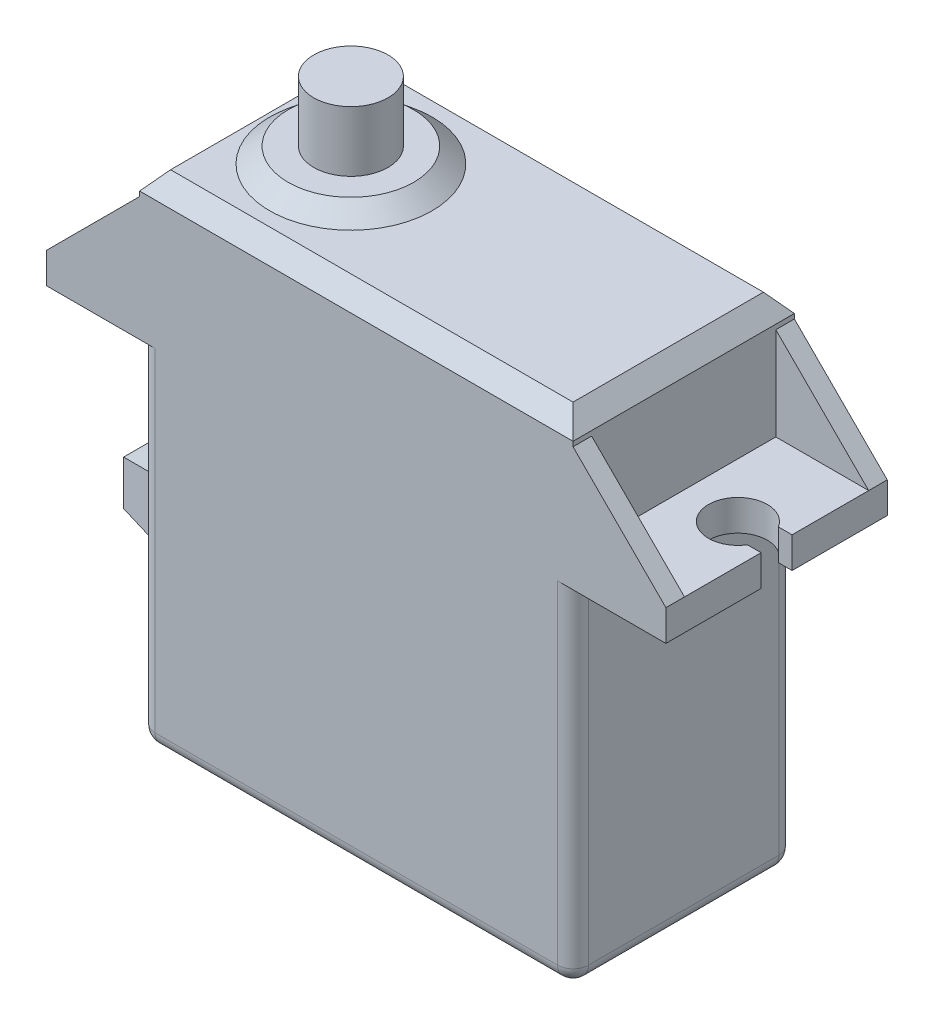
from build123d import *
from OCP.BRepFilletAPI import BRepFilletAPI_MakeChamfer

# Parameters (mm, degrees)
ESQUISSE1_W                  = 28
ESQUISSE1_H                  = 32
BOSS_EXTRU_1_DEPTH           = 7.15
BOSS_EXTRU_2_DEPTH           = 6
CHANFREIN1_SIZE              = 6
ENL_V_MAT_EXTRU_1_DEPTH      = 6
CHANFREIN1_OF_SYM_TRIE1_SIZE = 6
CONG_1_R                     = 1
ESQUISSE4_R                  = 5.25
BOSS_EXTRU_3_DEPTH           = 1
CHANFREIN2_SIZE2             = 1.191753593
CHANFREIN2_SIZE              = 1
ESQUISSE5_R                  = 2.4
BOSS_EXTRU_4_DEPTH           = 3.9
CHANFREIN3_SIZE              = 1
CHANFREIN3_SIZE2             = 1.191753593
ESQUISSE6_W                  = 7.5
ESQUISSE6_H                  = 5
BOSS_EXTRU_5_DEPTH           = 6
CHANFREIN4_SIZE              = 6
CHANFREIN4_SIZE_2            = 1.057961884


with BuildPart() as part:
    # Esquisse1 → Boss.-Extru.1 (new, symmetric)
    with BuildSketch(Plane.XY):
        Rectangle(ESQUISSE1_W, ESQUISSE1_H)
    extrude(amount=BOSS_EXTRU_1_DEPTH, both=True)

    # Esquisse2 → Boss.-Extru.2 (add)
    with BuildSketch(Plane.ZY.offset(14)):
        Polygon((5.95, 14.5), (7.15, 14.5), (7.15, 6.5), (5.366521974, 6.5), (-5.315928015, 6.5), (-7.15, 6.5), (-7.15, 14.5), (-5.95, 14.5), (-5.95, 8.5), (5.95, 8.5), align=None)
    boss_extru_2 = extrude(amount=BOSS_EXTRU_2_DEPTH)

    # Chanfrein1
    chanfrein1_edges = [part.edges().sort_by_distance(p)[0] for p in [
        (-20, 14.5, 6.55),
        (-20, 14.5, -6.55),
    ]]
    chamfer(chanfrein1_edges, length=CHANFREIN1_SIZE - 0.0001)  # a hair under: the kernel refuses the full size

    # Esquisse3 → Enlèv. mat.-Extru.1 (cut)
    with BuildSketch(Plane(origin=(0, 8.5, 0), x_dir=(1, 0, 0), z_dir=(0, 1, 0))):
        with BuildLine():
            Line((-20, 1), (-19.115549442, 1))
            ThreePointArc((-19.115549442, 1), (-15.6, 0), (-19.115549442, -1))
            Line((-19.115549442, -1), (-20, -1))
            Line((-20, -1), (-20, 1))
        make_face()
    enl_v_mat_extru_1 = extrude(amount=-ENL_V_MAT_EXTRU_1_DEPTH, mode=Mode.SUBTRACT)

    # Symétrie1: Boss.-Extru.2, Enlèv. mat.-Extru.1 across plane
    add(boss_extru_2.mirror(Plane(origin=(0, 0, 0), x_dir=(0, 0, 1), z_dir=(1, 0, 0))))
    add(enl_v_mat_extru_1.mirror(Plane(origin=(0, 0, 0), x_dir=(0, 0, 1), z_dir=(1, 0, 0))), mode=Mode.SUBTRACT)

    # Chanfrein1 of Symétrie1
    chanfrein1_of_sym_trie1_edges = [part.edges().sort_by_distance(p)[0] for p in [
        (20, 14.5, 6.55),
        (20, 14.5, -6.55),
    ]]
    chamfer(chanfrein1_of_sym_trie1_edges, length=CHANFREIN1_OF_SYM_TRIE1_SIZE - 0.0001)  # a hair under: the kernel refuses the full size

    # Congé1
    cong_1_edges = [part.edges().sort_by_distance(p)[0] for p in [
        (-14, -16, 0),
        (-14, -4.75, -7.15),
        (-14, -4.75, 7.15),
        (14, -4.75, -7.15),
        (14, -4.75, 7.15),
        (0, -16, -7.15),
        (0, -16, 7.15),
        (14, -16, 0),
    ]]
    fillet(cong_1_edges, radius=CONG_1_R)

    # Esquisse4 → Boss.-Extru.3 (add)
    with BuildSketch(Plane(origin=(0, 16, 0), x_dir=(1, 0, 0), z_dir=(0, 1, 0))):
        with Locations(Location((-7.5, 0, 0), (0, 0, 90))):
            Circle(ESQUISSE4_R)
    extrude(amount=BOSS_EXTRU_3_DEPTH)

    # Chanfrein2
    chanfrein2_edges = [part.edges().sort_by_distance(p)[0] for p in [
        (-7.5, 17, 5.25),
    ]]
    chanfrein2_side = [part.faces().sort_by_distance(p)[0] for p in [
        (-7.5, 16.98, 5.25),
    ]]
    chamfer(chanfrein2_edges, length=CHANFREIN2_SIZE - 0.0001, length2=CHANFREIN2_SIZE2 - 0.0001, reference=chanfrein2_side[0])  # a hair under: the kernel refuses the full size

    # Esquisse5 → Boss.-Extru.4 (add)
    with BuildSketch(Plane(origin=(0, 17, 0), x_dir=(1, 0, 0), z_dir=(0, 1, 0))):
        with Locations(Location((-7.5, 0, 0), (0, 0, 270))):
            Circle(ESQUISSE5_R)
    extrude(amount=BOSS_EXTRU_4_DEPTH)

    # Chanfrein3
    chanfrein3_edges = [part.edges().sort_by_distance(p)[0] for p in [
        (14, 16, 0),
        (0, 16, -7.15),
        (0, 16, 7.15),
        (-14, 16, 0),
    ]]
    chanfrein3_side = [part.faces().sort_by_distance(p)[0] for p in [
        (2.069489218, 16, 0),
    ]]
    chamfer(chanfrein3_edges, length=CHANFREIN3_SIZE, length2=CHANFREIN3_SIZE2, reference=chanfrein3_side[0])

    # Esquisse6 → Boss.-Extru.5 (add)
    with BuildSketch(Plane.ZY.offset(14)):
        with Locations((-0.508404359, -7)):
            Rectangle(ESQUISSE6_W, ESQUISSE6_H)
    extrude(amount=BOSS_EXTRU_5_DEPTH)

    # Chanfrein4
    chanfrein4_edges_1 = [part.edges().sort_by_distance(p)[0] for p in [
        (-20, -7, -4.258404359),
    ]]
    chanfrein4_side_1 = [part.faces().sort_by_distance(p)[0] for p in [
        (-19.978840762, -7, -4.258404359),
    ]]
    chanfrein4_edges_2 = [part.edges().sort_by_distance(p)[0] for p in [
        (-20, -9.5, -0.508404359),
    ]]
    chanfrein4_side_2 = [part.faces().sort_by_distance(p)[0] for p in [
        (-19.978840762, -9.5, -0.508404359),
    ]]
    chanfrein4_edges_3 = [part.edges().sort_by_distance(p)[0] for p in [
        (-20, -7, 3.241595641),
    ]]
    chanfrein4_side_3 = [part.faces().sort_by_distance(p)[0] for p in [
        (-19.978840762, -7, 3.241595641),
    ]]
    chanfrein4_edges_4 = [part.edges().sort_by_distance(p)[0] for p in [
        (-20, -4.5, -0.508404359),
    ]]
    chanfrein4_side_4 = [part.faces().sort_by_distance(p)[0] for p in [
        (-19.978840762, -4.5, -0.508404359),
    ]]
    chanfrein4 = BRepFilletAPI_MakeChamfer(part.part.solid().wrapped)
    for e in chanfrein4_edges_1:
        chanfrein4.Add(CHANFREIN4_SIZE - 0.0001, CHANFREIN4_SIZE_2 - 0.0001, e.wrapped, chanfrein4_side_1[0].wrapped)
    for e in chanfrein4_edges_2:
        chanfrein4.Add(CHANFREIN4_SIZE - 0.0001, CHANFREIN4_SIZE_2 - 0.0001, e.wrapped, chanfrein4_side_2[0].wrapped)
    for e in chanfrein4_edges_3:
        chanfrein4.Add(CHANFREIN4_SIZE - 0.0001, CHANFREIN4_SIZE_2 - 0.0001, e.wrapped, chanfrein4_side_3[0].wrapped)
    for e in chanfrein4_edges_4:
        chanfrein4.Add(CHANFREIN4_SIZE - 0.0001, CHANFREIN4_SIZE_2 - 0.0001, e.wrapped, chanfrein4_side_4[0].wrapped)
    add(Compound.cast(chanfrein4.Shape()), mode=Mode.REPLACE)  # a hair under: the kernel refuses the full size


solid = part.part
